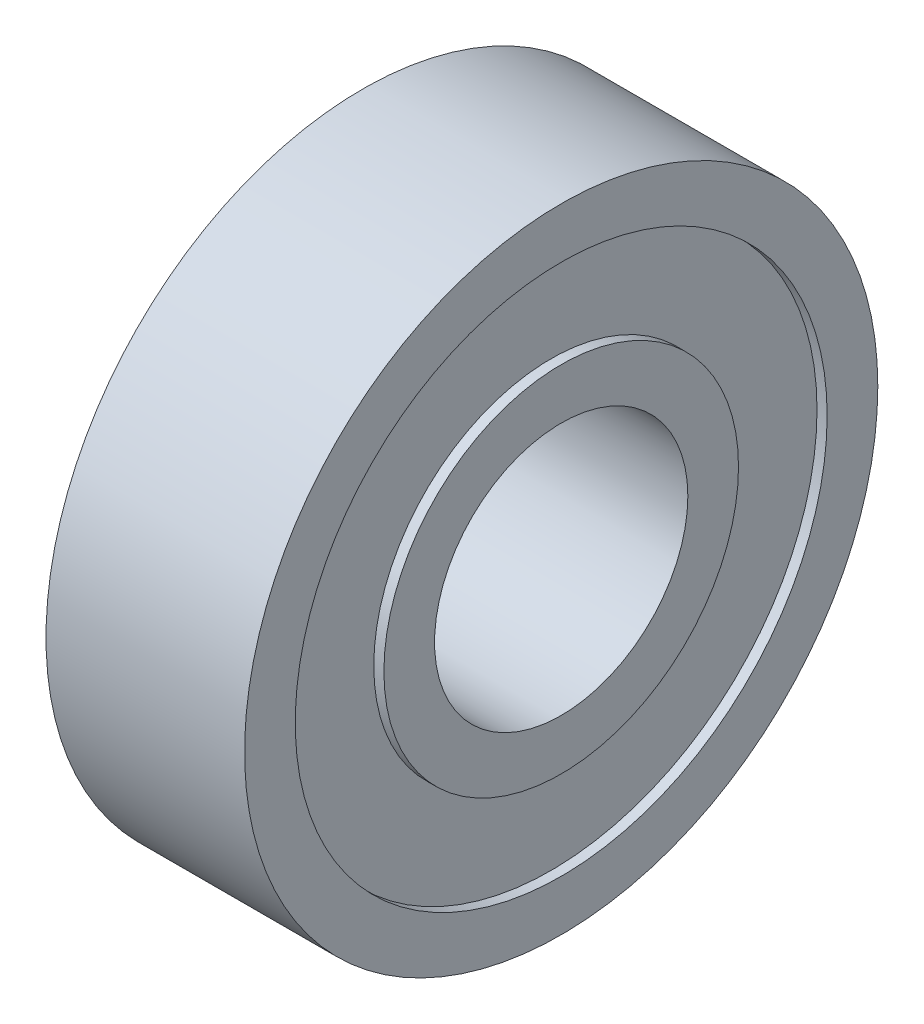
from build123d import *

# Parameters (mm, degrees)
SKETCH1_R           = 7.9375
SKETCH1_R_2         = 3.175
BOSS_EXTRUDE1_DEPTH = 2.4892
SKETCH2_R           = 6.6675
SKETCH2_R_2         = 4.445
CUT_EXTRUDE1_DEPTH  = 0.254


with BuildPart() as part:
    # Sketch1 → Boss-Extrude1 (new, symmetric)
    with BuildSketch(Plane(origin=(0, 0, 0), x_dir=(0, 0, -1), z_dir=(1, 0, 0))):
        Circle(SKETCH1_R)
        Circle(SKETCH1_R_2, mode=Mode.SUBTRACT)
    extrude(amount=BOSS_EXTRUDE1_DEPTH, both=True)

    # Sketch2 → Cut-Extrude1 (cut)
    with BuildSketch(Plane(origin=(2.4892, 0, 0), x_dir=(0, 0, -1), z_dir=(1, 0, 0))):
        Circle(SKETCH2_R)
        Circle(SKETCH2_R_2, mode=Mode.SUBTRACT)
    cut_extrude1 = extrude(amount=-CUT_EXTRUDE1_DEPTH, mode=Mode.SUBTRACT)

    # Mirror1: Cut-Extrude1 across plane
    add(cut_extrude1.mirror(Plane(origin=(0, 0, 0), x_dir=(0, 0, 1), z_dir=(1, 0, 0))), mode=Mode.SUBTRACT)


solid = part.part
